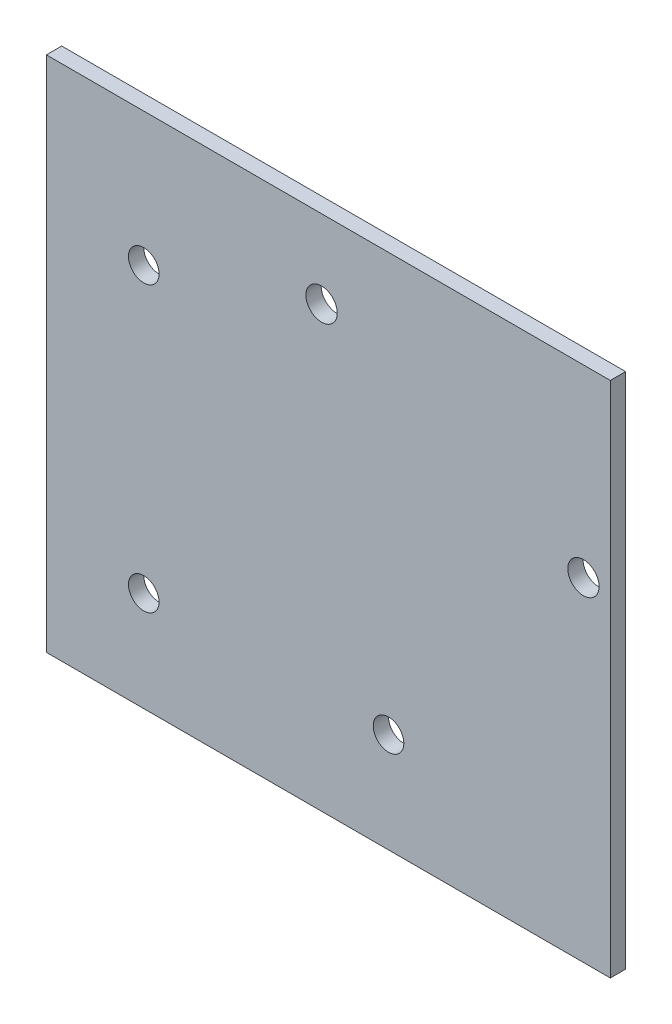
from build123d import *

# Parameters (mm, degrees)
SKETCH1_W           = 117.049703369
SKETCH1_H           = 107.411334798
SKETCH1_R           = 3.175
SKETCH1_R_2         = 3.2512
BOSS_EXTRUDE1_DEPTH = 3.175


with BuildPart() as part:
    # Sketch1 → Boss-Extrude1 (new body)
    with BuildSketch(Plane.XY):
        with Locations((63.712063523, 150.899612868)):
            Rectangle(SKETCH1_W, SKETCH1_H)
        with Locations((25.4, 117.928571429)):
            Circle(SKETCH1_R, mode=Mode.SUBTRACT)
        with Locations((25.4, 176.892857143)):
            Circle(SKETCH1_R, mode=Mode.SUBTRACT)
        with Locations((76.2, 117.928571429)):
            Circle(SKETCH1_R, mode=Mode.SUBTRACT)
        with Locations((116.658054975, 166.37)):
            Circle(SKETCH1_R_2, mode=Mode.SUBTRACT)
        with Locations((62.302054975, 188.357795731)):
            Circle(SKETCH1_R_2, mode=Mode.SUBTRACT)
    extrude(amount=BOSS_EXTRUDE1_DEPTH)


solid = part.part
